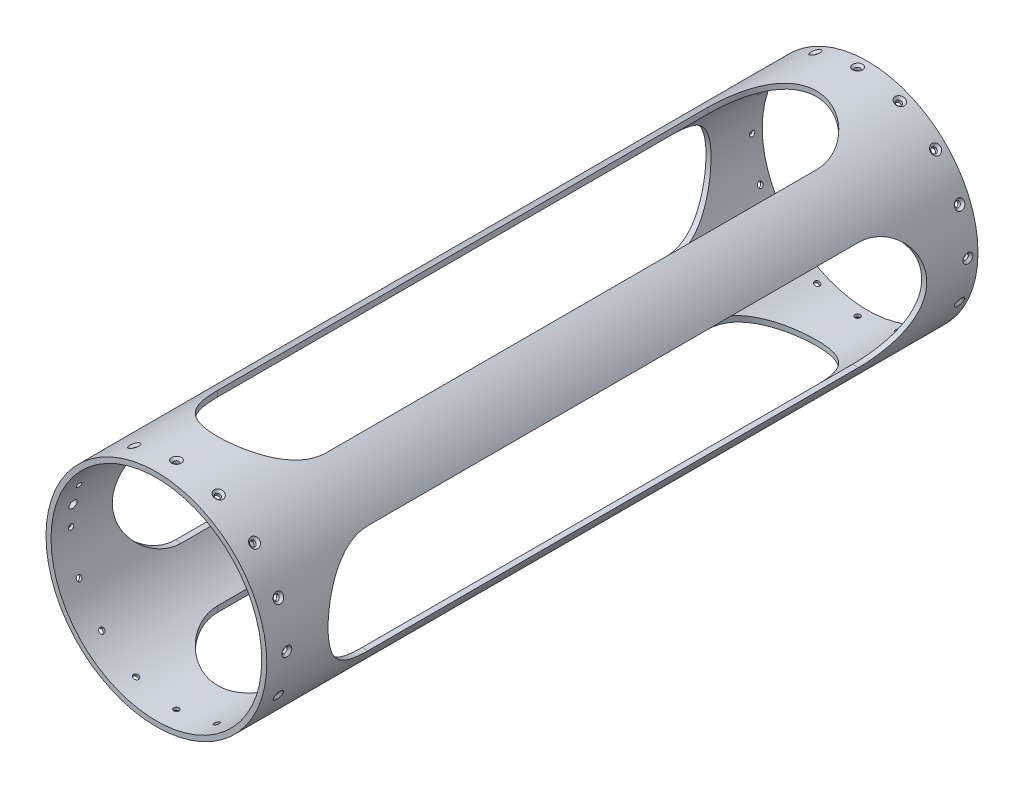
from build123d import *

# Parameters (mm, degrees)
SKETCH1_R                                       = 69.85
SKETCH1_R_2                                     = 66.675
EXTRUDE1_DEPTH                                  = 228.2063
CSK_FOR_M3_FLAT_HEAD_MACHINE_SCREW1_D           = 3.4
CSK_FOR_M3_FLAT_HEAD_MACHINE_SCREW1_CSINK_D     = 6.3
CSK_FOR_M3_FLAT_HEAD_MACHINE_SCREW1_CSINK_ANGLE = 90
EXTRUDE2_DEPTH                                  = 249.668776557
CIRPATTERN2_COUNT                               = 4
CIRPATTERN1_COUNT                               = 16
MIRROR1_COPY_1_DEPTH                            = 249.668776557
MIRROR1_COPY_2_DEPTH                            = 249.668776557
MIRROR1_COPY_3_DEPTH                            = 249.668776557
MIRROR1_COPY_4_D                                = 3.4
MIRROR1_COPY_4_CSINK_D                          = 6.3
MIRROR1_COPY_4_CSINK_ANGLE                      = 90
MIRROR1_COPY_5_D                                = 3.4
MIRROR1_COPY_5_CSINK_D                          = 6.3
MIRROR1_COPY_5_CSINK_ANGLE                      = 90
MIRROR1_COPY_6_D                                = 3.4
MIRROR1_COPY_6_CSINK_D                          = 6.3
MIRROR1_COPY_6_CSINK_ANGLE                      = 90
MIRROR1_COPY_7_D                                = 3.4
MIRROR1_COPY_7_CSINK_D                          = 6.3
MIRROR1_COPY_7_CSINK_ANGLE                      = 90
MIRROR1_COPY_8_D                                = 3.4
MIRROR1_COPY_8_CSINK_D                          = 6.3
MIRROR1_COPY_8_CSINK_ANGLE                      = 90
MIRROR1_COPY_9_D                                = 3.4
MIRROR1_COPY_9_CSINK_D                          = 6.3
MIRROR1_COPY_9_CSINK_ANGLE                      = 90
MIRROR1_COPY_10_D                               = 3.4
MIRROR1_COPY_10_CSINK_D                         = 6.3
MIRROR1_COPY_10_CSINK_ANGLE                     = 90
MIRROR1_COPY_11_D                               = 3.4
MIRROR1_COPY_11_CSINK_D                         = 6.3
MIRROR1_COPY_11_CSINK_ANGLE                     = 90
MIRROR1_COPY_12_D                               = 3.4
MIRROR1_COPY_12_CSINK_D                         = 6.3
MIRROR1_COPY_12_CSINK_ANGLE                     = 90
MIRROR1_COPY_13_D                               = 3.4
MIRROR1_COPY_13_CSINK_D                         = 6.3
MIRROR1_COPY_13_CSINK_ANGLE                     = 90
MIRROR1_COPY_14_D                               = 3.4
MIRROR1_COPY_14_CSINK_D                         = 6.3
MIRROR1_COPY_14_CSINK_ANGLE                     = 90
MIRROR1_COPY_15_D                               = 3.4
MIRROR1_COPY_15_CSINK_D                         = 6.3
MIRROR1_COPY_15_CSINK_ANGLE                     = 90
MIRROR1_COPY_16_D                               = 3.4
MIRROR1_COPY_16_CSINK_D                         = 6.3
MIRROR1_COPY_16_CSINK_ANGLE                     = 90
MIRROR1_COPY_17_D                               = 3.4
MIRROR1_COPY_17_CSINK_D                         = 6.3
MIRROR1_COPY_17_CSINK_ANGLE                     = 90
MIRROR1_COPY_18_D                               = 3.4
MIRROR1_COPY_18_CSINK_D                         = 6.3
MIRROR1_COPY_18_CSINK_ANGLE                     = 90
EXTRUDE3_START                                  = -6.35
SKETCH6_R                                       = 69.85
EXTRUDE3_DEPTH                                  = 6.35
F_10_CLEARANCE_HOLE1_D                          = 5.1054
F_10_CLEARANCE_HOLE1_DEPTH                      = 9.652
F_10_CLEARANCE_HOLE1_TIP                        = 1.533816902


with BuildPart() as part:
    # Sketch1 → Extrude1 (new body)
    with BuildSketch(Plane.XY):
        Circle(SKETCH1_R)
        Circle(SKETCH1_R_2, mode=Mode.SUBTRACT)
    extrude1 = extrude(amount=EXTRUDE1_DEPTH)

    # CSK for M3 Flat Head Machine Screw1 (through all)
    with Locations(Plane(origin=(0, -69.85, 215.5063), x_dir=(1, 0, 0), z_dir=(0, -1, 0))):
        with Locations((0, 0)):
            csk_for_m3_flat_head_machine_screw1 = CounterSinkHole(CSK_FOR_M3_FLAT_HEAD_MACHINE_SCREW1_D / 2, CSK_FOR_M3_FLAT_HEAD_MACHINE_SCREW1_CSINK_D / 2, counter_sink_angle=CSK_FOR_M3_FLAT_HEAD_MACHINE_SCREW1_CSINK_ANGLE)

    # Sketch5 → Extrude2 (cut, symmetric)
    with BuildSketch(Plane(origin=(0, 0, 0), x_dir=(1, 0, 0), z_dir=(0, 1, 0))):
        with BuildLine():
            Line((0, 0), (34.29, 0))
            Line((34.29, 0), (34.29, -155.139189337))
            ThreePointArc((34.29, -155.139189337), (0, -189.429189337), (-34.29, -155.139189337))
            Line((-34.29, -155.139189337), (-34.29, 0))
            Line((-34.29, 0), (0, 0))
        make_face()
    extrude2 = extrude(amount=EXTRUDE2_DEPTH, both=True, mode=Mode.SUBTRACT)

    # CirPattern2: Extrude2 ×4 about axis
    cirpattern2_axis = Axis((0, 0, 228.2063), (0, 0, -1))
    for i in range(1, CIRPATTERN2_COUNT):
        add(extrude2.rotate(cirpattern2_axis, i * 360 / CIRPATTERN2_COUNT), mode=Mode.SUBTRACT)

    # CirPattern1: CSK for M3 Flat Head Machine Screw1 ×16 about axis
    cirpattern1_axis = Axis((0, 0, 228.2063), (0, 0, -1))
    for i in range(1, CIRPATTERN1_COUNT):
        add(csk_for_m3_flat_head_machine_screw1.rotate(cirpattern1_axis, i * 360 / CIRPATTERN1_COUNT), mode=Mode.SUBTRACT)

    # Mirror1: Extrude1, CSK for M3 Flat Head Machine Screw1, Extrude2 across plane
    add(extrude1.mirror(Plane.XY))
    add(csk_for_m3_flat_head_machine_screw1.mirror(Plane.XY), mode=Mode.SUBTRACT)
    add(extrude2.mirror(Plane.XY), mode=Mode.SUBTRACT)

    # Mirror1 copy 1 sketch → Mirror1 copy 1 (cut, symmetric)
    with BuildSketch(Plane(origin=(0, 0, 0), x_dir=(0, -1, 0), z_dir=(1, 0, 0))):
        with BuildLine():
            Line((0, 0), (34.29, 0))
            Line((34.29, 0), (34.29, 155.139189337))
            ThreePointArc((34.29, 155.139189337), (0, 189.429189337), (-34.29, 155.139189337))
            Line((-34.29, 155.139189337), (-34.29, 0))
            Line((-34.29, 0), (0, 0))
        make_face()
    extrude(amount=MIRROR1_COPY_1_DEPTH, both=True, mode=Mode.SUBTRACT)

    # Mirror1 copy 2 sketch → Mirror1 copy 2 (cut, symmetric)
    with BuildSketch(Plane(origin=(0, 0, 0), x_dir=(-1, 0, 0), z_dir=(0, -1, 0))):
        with BuildLine():
            Line((0, 0), (34.29, 0))
            Line((34.29, 0), (34.29, 155.139189337))
            ThreePointArc((34.29, 155.139189337), (0, 189.429189337), (-34.29, 155.139189337))
            Line((-34.29, 155.139189337), (-34.29, 0))
            Line((-34.29, 0), (0, 0))
        make_face()
    extrude(amount=MIRROR1_COPY_2_DEPTH, both=True, mode=Mode.SUBTRACT)

    # Mirror1 copy 3 sketch → Mirror1 copy 3 (cut, symmetric)
    with BuildSketch(Plane(origin=(0, 0, 0), x_dir=(0, 1, 0), z_dir=(-1, 0, 0))):
        with BuildLine():
            Line((0, 0), (34.29, 0))
            Line((34.29, 0), (34.29, 155.139189337))
            ThreePointArc((34.29, 155.139189337), (0, 189.429189337), (-34.29, 155.139189337))
            Line((-34.29, 155.139189337), (-34.29, 0))
            Line((-34.29, 0), (0, 0))
        make_face()
    extrude(amount=MIRROR1_COPY_3_DEPTH, both=True, mode=Mode.SUBTRACT)

    # Mirror1 copy 4 (through all)
    with Locations(Plane(origin=(-26.730437751, -64.532985346, -215.5063), x_dir=(0.9238795325112868, -0.3826834323650896, 0), z_dir=(-0.3826834323650896, -0.9238795325112868, 0))):
        with Locations((0, 0)):
            CounterSinkHole(MIRROR1_COPY_4_D / 2, MIRROR1_COPY_4_CSINK_D / 2, counter_sink_angle=MIRROR1_COPY_4_CSINK_ANGLE)

    # Mirror1 copy 5 (through all)
    with Locations(Plane(origin=(-49.391408666, -49.391408666, -215.5063), x_dir=(0.7071067811865477, -0.7071067811865474, 0), z_dir=(-0.7071067811865474, -0.7071067811865477, 0))):
        with Locations((0, 0)):
            CounterSinkHole(MIRROR1_COPY_5_D / 2, MIRROR1_COPY_5_CSINK_D / 2, counter_sink_angle=MIRROR1_COPY_5_CSINK_ANGLE)

    # Mirror1 copy 6 (through all)
    with Locations(Plane(origin=(-64.532985346, -26.730437751, -215.5063), x_dir=(0.38268343236509, -0.9238795325112866, 0), z_dir=(-0.9238795325112866, -0.38268343236509, 0))):
        with Locations((0, 0)):
            CounterSinkHole(MIRROR1_COPY_6_D / 2, MIRROR1_COPY_6_CSINK_D / 2, counter_sink_angle=MIRROR1_COPY_6_CSINK_ANGLE)

    # Mirror1 copy 7 (through all)
    with Locations(Plane(origin=(-69.85, 0, -215.5063), x_dir=(0, -1, 0), z_dir=(-1, 0, 0))):
        with Locations((0, 0)):
            CounterSinkHole(MIRROR1_COPY_7_D / 2, MIRROR1_COPY_7_CSINK_D / 2, counter_sink_angle=MIRROR1_COPY_7_CSINK_ANGLE)

    # Mirror1 copy 8 (through all)
    with Locations(Plane(origin=(-64.532985346, 26.730437751, -215.5063), x_dir=(-0.38268343236508956, -0.9238795325112868, 0), z_dir=(-0.9238795325112868, 0.38268343236508956, 0))):
        with Locations((0, 0)):
            CounterSinkHole(MIRROR1_COPY_8_D / 2, MIRROR1_COPY_8_CSINK_D / 2, counter_sink_angle=MIRROR1_COPY_8_CSINK_ANGLE)

    # Mirror1 copy 9 (through all)
    with Locations(Plane(origin=(-49.391408666, 49.391408666, -215.5063), x_dir=(-0.7071067811865474, -0.7071067811865477, 0), z_dir=(-0.7071067811865477, 0.7071067811865474, 0))):
        with Locations((0, 0)):
            CounterSinkHole(MIRROR1_COPY_9_D / 2, MIRROR1_COPY_9_CSINK_D / 2, counter_sink_angle=MIRROR1_COPY_9_CSINK_ANGLE)

    # Mirror1 copy 10 (through all)
    with Locations(Plane(origin=(-26.730437751, 64.532985346, -215.5063), x_dir=(-0.9238795325112866, -0.38268343236509006, 0), z_dir=(-0.38268343236509006, 0.9238795325112866, 0))):
        with Locations((0, 0)):
            CounterSinkHole(MIRROR1_COPY_10_D / 2, MIRROR1_COPY_10_CSINK_D / 2, counter_sink_angle=MIRROR1_COPY_10_CSINK_ANGLE)

    # Mirror1 copy 11 (through all)
    with Locations(Plane(origin=(0, 69.85, -215.5063), x_dir=(-1, 0, 0), z_dir=(0, 1, 0))):
        with Locations((0, 0)):
            CounterSinkHole(MIRROR1_COPY_11_D / 2, MIRROR1_COPY_11_CSINK_D / 2, counter_sink_angle=MIRROR1_COPY_11_CSINK_ANGLE)

    # Mirror1 copy 12 (through all)
    with Locations(Plane(origin=(26.730437751, 64.532985346, -215.5063), x_dir=(-0.923879532511287, 0.3826834323650895, 0), z_dir=(0.3826834323650895, 0.923879532511287, 0))):
        with Locations((0, 0)):
            CounterSinkHole(MIRROR1_COPY_12_D / 2, MIRROR1_COPY_12_CSINK_D / 2, counter_sink_angle=MIRROR1_COPY_12_CSINK_ANGLE)

    # Mirror1 copy 13 (through all)
    with Locations(Plane(origin=(49.391408666, 49.391408666, -215.5063), x_dir=(-0.7071067811865478, 0.7071067811865474, 0), z_dir=(0.7071067811865474, 0.7071067811865478, 0))):
        with Locations((0, 0)):
            CounterSinkHole(MIRROR1_COPY_13_D / 2, MIRROR1_COPY_13_CSINK_D / 2, counter_sink_angle=MIRROR1_COPY_13_CSINK_ANGLE)

    # Mirror1 copy 14 (through all)
    with Locations(Plane(origin=(64.532985346, 26.730437751, -215.5063), x_dir=(-0.38268343236508967, 0.9238795325112867, 0), z_dir=(0.9238795325112867, 0.38268343236508967, 0))):
        with Locations((0, 0)):
            CounterSinkHole(MIRROR1_COPY_14_D / 2, MIRROR1_COPY_14_CSINK_D / 2, counter_sink_angle=MIRROR1_COPY_14_CSINK_ANGLE)

    # Mirror1 copy 15 (through all)
    with Locations(Plane(origin=(69.85, 0, -215.5063), x_dir=(0, 1, 0), z_dir=(1, 0, 0))):
        with Locations((0, 0)):
            CounterSinkHole(MIRROR1_COPY_15_D / 2, MIRROR1_COPY_15_CSINK_D / 2, counter_sink_angle=MIRROR1_COPY_15_CSINK_ANGLE)

    # Mirror1 copy 16 (through all)
    with Locations(Plane(origin=(64.532985346, -26.730437751, -215.5063), x_dir=(0.38268343236508984, 0.9238795325112867, 0), z_dir=(0.9238795325112867, -0.38268343236508984, 0))):
        with Locations((0, 0)):
            CounterSinkHole(MIRROR1_COPY_16_D / 2, MIRROR1_COPY_16_CSINK_D / 2, counter_sink_angle=MIRROR1_COPY_16_CSINK_ANGLE)

    # Mirror1 copy 17 (through all)
    with Locations(Plane(origin=(49.391408666, -49.391408666, -215.5063), x_dir=(0.7071067811865472, 0.7071067811865478, 0), z_dir=(0.7071067811865478, -0.7071067811865472, 0))):
        with Locations((0, 0)):
            CounterSinkHole(MIRROR1_COPY_17_D / 2, MIRROR1_COPY_17_CSINK_D / 2, counter_sink_angle=MIRROR1_COPY_17_CSINK_ANGLE)

    # Mirror1 copy 18 (through all)
    with Locations(Plane(origin=(26.730437751, -64.532985346, -215.5063), x_dir=(0.9238795325112867, 0.3826834323650897, 0), z_dir=(0.3826834323650897, -0.9238795325112867, 0))):
        with Locations((0, 0)):
            CounterSinkHole(MIRROR1_COPY_18_D / 2, MIRROR1_COPY_18_CSINK_D / 2, counter_sink_angle=MIRROR1_COPY_18_CSINK_ANGLE)

    # Sketch6 → Extrude3 (cut)
    with BuildSketch(Plane(origin=(0, 0, -228.2063), x_dir=(-1, 0, 0), z_dir=(0, 0, -1)).offset(EXTRUDE3_START)):
        Circle(SKETCH6_R)
    extrude(amount=EXTRUDE3_DEPTH, mode=Mode.SUBTRACT)

    # #10 Clearance Hole1
    with Locations(Plane(origin=(-68.507851836, 13.627058993, 215.5063), x_dir=(-0.19509032201613202, -0.9807852804032298, 0), z_dir=(-0.9807852804032297, 0.195090322016132, 0))):
        with Locations((0, 0)):
            Hole(F_10_CLEARANCE_HOLE1_D / 2, depth=F_10_CLEARANCE_HOLE1_DEPTH)
            with Locations((0, 0, -(F_10_CLEARANCE_HOLE1_DEPTH + F_10_CLEARANCE_HOLE1_TIP / 2))):  # 118° drill point
                Cone(0, F_10_CLEARANCE_HOLE1_D / 2, F_10_CLEARANCE_HOLE1_TIP, mode=Mode.SUBTRACT)


solid = part.part
